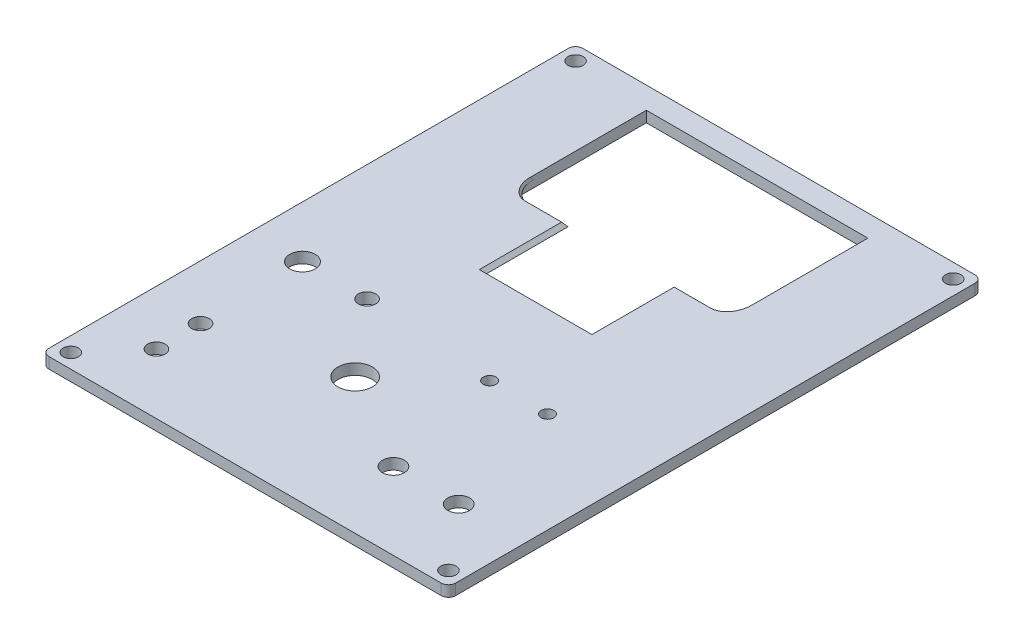
from build123d import *

# Parameters (mm, degrees)
SKETCH1_W               = 112
SKETCH1_H               = 147
BOSS_EXTRUDE1_DEPTH     = 3
SKETCH2_W               = 61
SKETCH2_H               = 61
BOSS_EXTRUDE2_DEPTH     = 3
SKETCH2_2_W             = 61
SKETCH2_2_H             = 61
CUT_EXTRUDE1_DEPTH      = 93.451338552
SKETCH3_R               = 1.75
SKETCH3_R_2             = 2.4
SKETCH3_R_3             = 4.75
SKETCH3_R_4             = 3
SKETCH3_R_5             = 3.5
CUT_EXTRUDE2_DEPTH      = 10
SKETCH4_R               = 2.1
CUT_EXTRUDE3_DEPTH      = 5
MIRROR2_COPY_1_SKETCH_R = 2.1
MIRROR2_COPY_1_DEPTH    = 5
FILLET1_R               = 2
SKETCH5_W               = 37.020085877
SKETCH5_H               = 31.91839976
BOSS_EXTRUDE4_DEPTH     = 1
CHAMFER4_SIZE           = 2.34385688
CHAMFER4_SIZE_2         = 3
MIRROR9_START           = 14.5
MIRROR9_DEPTH           = 16
MIRROR9_START_2         = 7
MIRROR9_2_DEPTH         = 1.838834765
FILLET2_R               = 5


with BuildPart() as part:
    # Sketch1 → Boss-Extrude1 (new body)
    with BuildSketch(Plane(origin=(0, 0, 0), x_dir=(1, 0, 0), z_dir=(0, 1, 0))):
        Rectangle(SKETCH1_W, SKETCH1_H)
    extrude(amount=BOSS_EXTRUDE1_DEPTH)

    # Sketch2 → Boss-Extrude2 (add)
    with BuildSketch(Plane(origin=(0, 3, 0), x_dir=(1, 0, 0), z_dir=(0, 1, 0))):
        with Locations((0, 37)):
            Rectangle(SKETCH2_W, SKETCH2_H)
    extrude(amount=-BOSS_EXTRUDE2_DEPTH)

    # Sketch2<2> → Cut-Extrude1 (cut, through all)
    with BuildSketch(Plane(origin=(0, 3, 0), x_dir=(1, 0, 0), z_dir=(0, 1, 0))):
        with Locations((0, 37)):
            Rectangle(SKETCH2_2_W, SKETCH2_2_H)
    extrude(amount=-CUT_EXTRUDE1_DEPTH, mode=Mode.SUBTRACT)

    # Sketch3 → Cut-Extrude2 (cut)
    with BuildSketch(Plane(origin=(0, 3, 0), x_dir=(1, 0, 0), z_dir=(0, 1, 0))):
        with Locations(Location((12.415, -18.57, 0), (0, 0, 270))):
            Circle(SKETCH3_R)
        with Locations(Location((28.345, -18.57, 0), (0, 0, 270))):
            Circle(SKETCH3_R)
        with Locations(Location((-41.010240817, -44.763305049, 0), (0, 0, 270))):
            Circle(SKETCH3_R_2)
        with Locations(Location((-41.010240817, -56.907347776, 0), (0, 0, 270))):
            Circle(SKETCH3_R_2)
        with Locations(Location((-23.966529419, -15.947077361, 0), (0, 0, 270))):
            Circle(SKETCH3_R_2)
        with Locations(Location((-7, -36.196378326, 0), (0, 0, 270))):
            Circle(SKETCH3_R_3)
        with Locations(Location((19.612753758, -52.279000863, 0), (0, 0, 270))):
            Circle(SKETCH3_R_4)
        with Locations(Location((37.612753758, -52.279000863, 0), (0, 0, 270))):
            Circle(SKETCH3_R_4)
        with Locations(Location((-41.753496243, -15.947077361, 0), (0, 0, 270))):
            Circle(SKETCH3_R_5)
    extrude(amount=-CUT_EXTRUDE2_DEPTH, mode=Mode.SUBTRACT)

    # Sketch4 → Cut-Extrude3 (cut)
    with BuildSketch(Plane(origin=(0, 3, 0), x_dir=(1, 0, 0), z_dir=(0, 1, 0))):
        with Locations(Location((-52, -69.5, 0), (0, 0, 270))):
            Circle(SKETCH4_R)
    cut_extrude3 = extrude(amount=-CUT_EXTRUDE3_DEPTH, mode=Mode.SUBTRACT)

    # Mirror1: Cut-Extrude3 across plane
    add(cut_extrude3.mirror(Plane(origin=(0, 0, 0), x_dir=(0, 0, 1), z_dir=(1, 0, 0))), mode=Mode.SUBTRACT)

    # Mirror2: Cut-Extrude3 across plane
    add(cut_extrude3.mirror(Plane.XY), mode=Mode.SUBTRACT)

    # Mirror2 copy 1 sketch → Mirror2 copy 1 (cut)
    with BuildSketch(Plane(origin=(0, 3, 0), x_dir=(-1, 0, 0), z_dir=(0, 1, 0))):
        with Locations(Location((-52, -69.5, 0), (0, 0, 270))):
            Circle(MIRROR2_COPY_1_SKETCH_R)
    extrude(amount=-MIRROR2_COPY_1_DEPTH, mode=Mode.SUBTRACT)

    # Fillet1
    fillet1_edges = [part.edges().sort_by_distance(p)[0] for p in [
        (56, 1.5, 73.5),
        (-56, 1.5, 73.5),
        (-56, 1.5, -73.5),
        (56, 1.5, -73.5),
    ]]
    fillet(fillet1_edges, radius=FILLET1_R)

    # Sketch5 → Boss-Extrude4 (add)
    with BuildSketch(Plane(origin=(0, 2, 0), x_dir=(1, 0, 0), z_dir=(0, 1, 0))):
        with Locations((-29.010042938, 15.54080012)):
            Rectangle(SKETCH5_W, SKETCH5_H)
    extrude(amount=BOSS_EXTRUDE4_DEPTH)

    # Chamfer1
    # the kernel refuses this chamfer: 5 mm, written as the material it takes off along each edge
    with BuildSketch(Plane(origin=(-10.5, 3, -44.35841494), x_dir=(-1, 0, 0), z_dir=(0, 0, 1))) as chamfer1_piece_1:
        with BuildLine():
            Line((5.141421356, -0.141421356), (-0.141421356, 5.141421356))
            Line((-0.141421356, 5.141421356), (-0.241421356, 5.141421356))
            ThreePointArc((-0.241421356, 5.141421356), (-0.1, 2.570710678), (-0.1, 0))
            Line((-0.1, 0), (0, -0.1))
            ThreePointArc((0, -0.1), (2.570710678, -0.1), (5.141421356, -0.241421356))
            Line((5.141421356, -0.241421356), (5.141421356, -0.141421356))
        make_face()
    extrude(amount=37.85841494, mode=Mode.SUBTRACT)

    # Chamfer4
    # the kernel refuses this chamfer: 3, 2.34385688 mm, written as the material it takes off along each edge
    with BuildSketch(Plane(origin=(-30.5, 3, -31.5), x_dir=(0, 0, 1), z_dir=(1, 0, 0))) as chamfer4_piece_1:
        Polygon((CHAMFER4_SIZE, 0), (0, CHAMFER4_SIZE_2), (0, 0), align=None)
    extrude(amount=22.738607652, mode=Mode.SUBTRACT)

    # Mirror9: read off the stored shape, not the designer's step
    # Mirror9 outline → Mirror9 (add)
    with BuildSketch(Plane.YZ.offset(MIRROR9_START)):
        Polygon((2, -29.937428747), (3, -29.15614312), (3, -6.5), (2, -6.5), align=None)
    extrude(amount=MIRROR9_DEPTH)

    # Mirror9 2 outline → Mirror9 2 (cut)
    with BuildSketch(Plane(origin=(0, 0, 0), x_dir=(0.7071067811865509, 0.707106781186544, 0), z_dir=(0.707106781186544, -0.707106781186551, 0)).offset(MIRROR9_START_2)):
        Polygon((13.081475452, -29.15614312), (13.081475452, -6.5), (11.66726189, -6.5), (11.66726189, -29.937428747), align=None)
    extrude(amount=MIRROR9_2_DEPTH, mode=Mode.SUBTRACT)

    # Fillet2
    # the kernel refuses this fillet: 5 mm, written as the material it adds along each edge
    with BuildSketch(Plane(origin=(-30.5, 12.850134419, -21.460374677), x_dir=(1, 0, 0), z_dir=(0, -0.788010753545573, -0.6156614754039254))) as fillet2_piece_1_section:
        with BuildLine():
            CenterArc((FILLET2_R, -FILLET2_R), FILLET2_R, 90, 90)
            Line((0, -FILLET2_R), (0, 0))
            Line((0, 0), (FILLET2_R, 0))
        make_face()
    fillet2_piece_1 = extrude(amount=26.269018215, mode=Mode.PRIVATE)
    fillet2_piece_1 = split(fillet2_piece_1, bisect_by=Plane(origin=(-30.5, 3, -21.460374677), z_dir=(0, -1, 0)), keep=Keep.TOP, mode=Mode.PRIVATE)
    fillet2_piece_1 = split(fillet2_piece_1, bisect_by=Plane(origin=(-30.5, 2, -21.460374677), z_dir=(0, 1, 0)), keep=Keep.TOP, mode=Mode.PRIVATE)
    add(fillet2_piece_1)
    with BuildSketch(Plane(origin=(30.5, -7.850134418, -37.633197192), x_dir=(0, 0.6156614755670328, -0.7880107534181395), z_dir=(0, 0.7880107534181395, 0.6156614755670328))) as fillet2_piece_2_section:
        with BuildLine():
            CenterArc((FILLET2_R, FILLET2_R), FILLET2_R, 180, 90)
            Line((0, FILLET2_R), (0, 0))
            Line((0, 0), (FILLET2_R, 0))
        make_face()
    fillet2_piece_2 = extrude(amount=26.269018215, mode=Mode.PRIVATE)
    fillet2_piece_2 = split(fillet2_piece_2, bisect_by=Plane(origin=(30.5, 3, -37.633197192), z_dir=(0, -1, 0)), keep=Keep.TOP, mode=Mode.PRIVATE)
    fillet2_piece_2 = split(fillet2_piece_2, bisect_by=Plane(origin=(30.5, 2, -37.633197192), z_dir=(0, 1, 0)), keep=Keep.TOP, mode=Mode.PRIVATE)
    add(fillet2_piece_2)


solid = part.part
